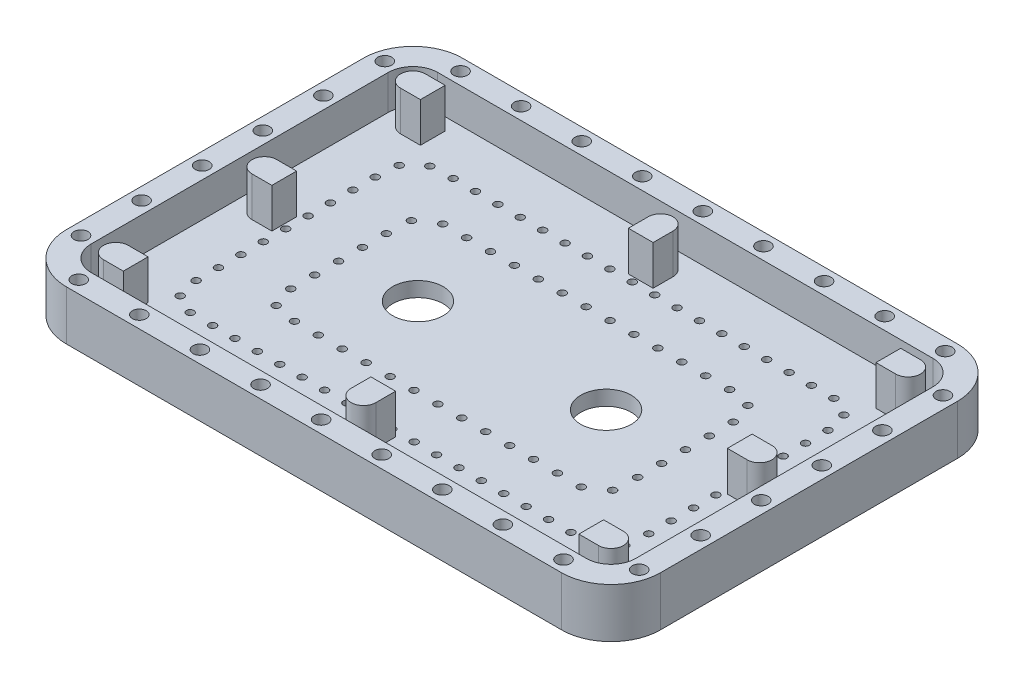
from build123d import *

# Parameters (mm, degrees)
SKETCH1_W                       = 120
SKETCH1_H                       = 80
BOSS_EXTRUDE1_DEPTH             = 10
SKETCH2_W                       = 110
SKETCH2_H                       = 70
CUT_EXTRUDE1_DEPTH              = 7
F_10_2_10_2_DIAMETER_HOLE1_D    = 10.2
FILLET1_R                       = 10
FILLET3_R                       = 5
F_2_5MM_CLEARANCE_DOWEL_HOLE1_D = 2.8
CRVPATTERN1_START               = -3
CRVPATTERN1_OUTLINE_R           = 1.4
CRVPATTERN1_DEPTH               = 10
F_1_5MM_DOWEL_HOLE2_D           = 1.5
CRVPATTERN3_START               = -3
CRVPATTERN3_OUTLINE_R           = 0.75
CRVPATTERN3_DEPTH               = 3
F_1_5MM_DOWEL_HOLE3_D           = 1.5
CRVPATTERN4_START               = -3
CRVPATTERN4_OUTLINE_R           = 0.75
CRVPATTERN4_DEPTH               = 3
BOSS_EXTRUDE2_DEPTH             = 8
SKETCH24_R                      = 2
CUT_EXTRUDE2_DEPTH              = 1.5
CRVPATTERN5_START               = -3
CRVPATTERN5_OUTLINE_R           = 2
CRVPATTERN5_OUTLINE_R_2         = 1.4
CRVPATTERN5_DEPTH               = 1.5


# Read off the part's stored shape, not the designer's step: CrvPattern1, CrvPattern3, CrvPattern4, CrvPattern5
with BuildPart() as part:
    # Sketch1 → Boss-Extrude1 (new body)
    with BuildSketch(Plane(origin=(0, 7, 0), x_dir=(1, 0, 0), z_dir=(0, 1, 0))):
        Rectangle(SKETCH1_W, SKETCH1_H)
    extrude(amount=-BOSS_EXTRUDE1_DEPTH)

    # Sketch2 → Cut-Extrude1 (cut)
    with BuildSketch(Plane(origin=(0, 7, 0), x_dir=(-1, 0, 0), z_dir=(0, 1, 0))):
        Rectangle(SKETCH2_W, SKETCH2_H)
    extrude(amount=-CUT_EXTRUDE1_DEPTH, mode=Mode.SUBTRACT)

    # Ø10.2 (10.2) Diameter Hole1 (through all)
    with Locations(Plane(origin=(0, 0, 0), x_dir=(1, 0, 0), z_dir=(0, 1, 0))):
        with Locations((19, 0), (-19, 0)):
            Hole(F_10_2_10_2_DIAMETER_HOLE1_D / 2)

    # Fillet1
    fillet1_edges = [part.edges().sort_by_distance(p)[0] for p in [
        (-60, 2, -40),
        (60, 2, -40),
        (60, 2, 40),
        (-60, 2, 40),
    ]]
    fillet(fillet1_edges, radius=FILLET1_R)

    # Fillet3
    fillet3_edges = [part.edges().sort_by_distance(p)[0] for p in [
        (-55, 3.5, 35),
        (-55, 3.5, -35),
        (55, 3.5, -35),
        (55, 3.5, 35),
    ]]
    fillet(fillet3_edges, radius=FILLET3_R)

    # Ø2.5mm Clearance Dowel Hole1 (through all)
    with Locations(Plane(origin=(0, 7, 0), x_dir=(1, 0, 0), z_dir=(0, 1, 0))):
        with Locations((50, 37.5)):
            Hole(F_2_5MM_CLEARANCE_DOWEL_HOLE1_D / 2)

    # CrvPattern1 outline → CrvPattern1 (cut)
    with BuildSketch(Plane(origin=(0, 0, 0), x_dir=(1, 0, 0), z_dir=(0, 1, 0)).offset(CRVPATTERN1_START)):
        with Locations((37.762537007, 37.5)):
            Circle(CRVPATTERN1_OUTLINE_R)
        with Locations((25.525074013, 37.5)):
            Circle(CRVPATTERN1_OUTLINE_R)
        with Locations((13.28761102, 37.5)):
            Circle(CRVPATTERN1_OUTLINE_R)
        with Locations((1.050148026, 37.5)):
            Circle(CRVPATTERN1_OUTLINE_R)
        with Locations((-11.187314967, 37.5)):
            Circle(CRVPATTERN1_OUTLINE_R)
        with Locations((-23.424777961, 37.5)):
            Circle(CRVPATTERN1_OUTLINE_R)
        with Locations((-35.662240954, 37.5)):
            Circle(CRVPATTERN1_OUTLINE_R)
        with Locations((-47.899703948, 37.5)):
            Circle(CRVPATTERN1_OUTLINE_R)
        with Locations((-57.320580195, 31.630676428)):
            Circle(CRVPATTERN1_OUTLINE_R)
        with Locations((-57.5, 19.406342516)):
            Circle(CRVPATTERN1_OUTLINE_R)
        with Locations((-57.5, 7.168879523)):
            Circle(CRVPATTERN1_OUTLINE_R)
        with Locations((-57.5, -5.068583471)):
            Circle(CRVPATTERN1_OUTLINE_R)
        with Locations((-57.5, -17.306046464)):
            Circle(CRVPATTERN1_OUTLINE_R)
        with Locations((-57.5, -29.543509458)):
            Circle(CRVPATTERN1_OUTLINE_R)
        with Locations((-50, -37.5)):
            Circle(CRVPATTERN1_OUTLINE_R)
        with Locations((-37.762537007, -37.5)):
            Circle(CRVPATTERN1_OUTLINE_R)
        with Locations((-25.525074013, -37.5)):
            Circle(CRVPATTERN1_OUTLINE_R)
        with Locations((-13.28761102, -37.5)):
            Circle(CRVPATTERN1_OUTLINE_R)
        with Locations((-1.050148026, -37.5)):
            Circle(CRVPATTERN1_OUTLINE_R)
        with Locations((11.187314967, -37.5)):
            Circle(CRVPATTERN1_OUTLINE_R)
        with Locations((23.424777961, -37.5)):
            Circle(CRVPATTERN1_OUTLINE_R)
        with Locations((35.662240954, -37.5)):
            Circle(CRVPATTERN1_OUTLINE_R)
        with Locations((47.899703948, -37.5)):
            Circle(CRVPATTERN1_OUTLINE_R)
        with Locations((57.320580195, -31.630676428)):
            Circle(CRVPATTERN1_OUTLINE_R)
        with Locations((57.5, -19.406342516)):
            Circle(CRVPATTERN1_OUTLINE_R)
        with Locations((57.5, -7.168879523)):
            Circle(CRVPATTERN1_OUTLINE_R)
        with Locations((57.5, 5.068583471)):
            Circle(CRVPATTERN1_OUTLINE_R)
        with Locations((57.5, 17.306046464)):
            Circle(CRVPATTERN1_OUTLINE_R)
        with Locations((57.5, 29.543509458)):
            Circle(CRVPATTERN1_OUTLINE_R)
    extrude(amount=CRVPATTERN1_DEPTH, mode=Mode.SUBTRACT)

    # Ø1.5mm Dowel Hole2 (through all)
    with Locations(Plane(origin=(0, 0, 0), x_dir=(1, 0, 0), z_dir=(0, 1, 0))):
        with Locations((40, 25)):
            Hole(F_1_5MM_DOWEL_HOLE2_D / 2)

    # CrvPattern3 outline → CrvPattern3 (cut)
    with BuildSketch(Plane(origin=(0, 0, 0), x_dir=(1, 0, 0), z_dir=(0, 1, 0)).offset(CRVPATTERN3_START)):
        with Locations((35.476401224, 25)):
            Circle(CRVPATTERN3_OUTLINE_R)
        with Locations((30.952802449, 25)):
            Circle(CRVPATTERN3_OUTLINE_R)
        with Locations((26.429203673, 25)):
            Circle(CRVPATTERN3_OUTLINE_R)
        with Locations((21.905604898, 25)):
            Circle(CRVPATTERN3_OUTLINE_R)
        with Locations((17.382006122, 25)):
            Circle(CRVPATTERN3_OUTLINE_R)
        with Locations((12.858407346, 25)):
            Circle(CRVPATTERN3_OUTLINE_R)
        with Locations((8.334808571, 25)):
            Circle(CRVPATTERN3_OUTLINE_R)
        with Locations((3.811209795, 25)):
            Circle(CRVPATTERN3_OUTLINE_R)
        with Locations((-0.71238898, 25)):
            Circle(CRVPATTERN3_OUTLINE_R)
        with Locations((-5.235987756, 25)):
            Circle(CRVPATTERN3_OUTLINE_R)
        with Locations((-9.759586532, 25)):
            Circle(CRVPATTERN3_OUTLINE_R)
        with Locations((-14.283185307, 25)):
            Circle(CRVPATTERN3_OUTLINE_R)
        with Locations((-18.806784083, 25)):
            Circle(CRVPATTERN3_OUTLINE_R)
        with Locations((-23.330382858, 25)):
            Circle(CRVPATTERN3_OUTLINE_R)
        with Locations((-27.853981634, 25)):
            Circle(CRVPATTERN3_OUTLINE_R)
        with Locations((-32.37758041, 25)):
            Circle(CRVPATTERN3_OUTLINE_R)
        with Locations((-36.901179185, 25)):
            Circle(CRVPATTERN3_OUTLINE_R)
        with Locations((-41.405574173, 24.798370687)):
            Circle(CRVPATTERN3_OUTLINE_R)
        with Locations((-44.64124129, 21.859806251)):
            Circle(CRVPATTERN3_OUTLINE_R)
        with Locations((-45, 17.382006122)):
            Circle(CRVPATTERN3_OUTLINE_R)
        with Locations((-45, 12.858407346)):
            Circle(CRVPATTERN3_OUTLINE_R)
        with Locations((-45, 8.334808571)):
            Circle(CRVPATTERN3_OUTLINE_R)
        with Locations((-45, 3.811209795)):
            Circle(CRVPATTERN3_OUTLINE_R)
        with Locations((-45, -0.71238898)):
            Circle(CRVPATTERN3_OUTLINE_R)
        with Locations((-45, -5.235987756)):
            Circle(CRVPATTERN3_OUTLINE_R)
        with Locations((-45, -9.759586532)):
            Circle(CRVPATTERN3_OUTLINE_R)
        with Locations((-45, -14.283185307)):
            Circle(CRVPATTERN3_OUTLINE_R)
        with Locations((-45, -18.806784083)):
            Circle(CRVPATTERN3_OUTLINE_R)
        with Locations((-43.931260104, -23.089529736)):
            Circle(CRVPATTERN3_OUTLINE_R)
        with Locations((-40, -25)):
            Circle(CRVPATTERN3_OUTLINE_R)
        with Locations((-35.476401224, -25)):
            Circle(CRVPATTERN3_OUTLINE_R)
        with Locations((-30.952802449, -25)):
            Circle(CRVPATTERN3_OUTLINE_R)
        with Locations((-26.429203673, -25)):
            Circle(CRVPATTERN3_OUTLINE_R)
        with Locations((-21.905604898, -25)):
            Circle(CRVPATTERN3_OUTLINE_R)
        with Locations((-17.382006122, -25)):
            Circle(CRVPATTERN3_OUTLINE_R)
        with Locations((-12.858407346, -25)):
            Circle(CRVPATTERN3_OUTLINE_R)
        with Locations((-8.334808571, -25)):
            Circle(CRVPATTERN3_OUTLINE_R)
        with Locations((-3.811209795, -25)):
            Circle(CRVPATTERN3_OUTLINE_R)
        with Locations((0.71238898, -25)):
            Circle(CRVPATTERN3_OUTLINE_R)
        with Locations((5.235987756, -25)):
            Circle(CRVPATTERN3_OUTLINE_R)
        with Locations((9.759586532, -25)):
            Circle(CRVPATTERN3_OUTLINE_R)
        with Locations((14.283185307, -25)):
            Circle(CRVPATTERN3_OUTLINE_R)
        with Locations((18.806784083, -25)):
            Circle(CRVPATTERN3_OUTLINE_R)
        with Locations((23.330382858, -25)):
            Circle(CRVPATTERN3_OUTLINE_R)
        with Locations((27.853981634, -25)):
            Circle(CRVPATTERN3_OUTLINE_R)
        with Locations((32.37758041, -25)):
            Circle(CRVPATTERN3_OUTLINE_R)
        with Locations((36.901179185, -25)):
            Circle(CRVPATTERN3_OUTLINE_R)
        with Locations((41.405574173, -24.798370687)):
            Circle(CRVPATTERN3_OUTLINE_R)
        with Locations((44.64124129, -21.859806251)):
            Circle(CRVPATTERN3_OUTLINE_R)
        with Locations((45, -17.382006122)):
            Circle(CRVPATTERN3_OUTLINE_R)
        with Locations((45, -12.858407346)):
            Circle(CRVPATTERN3_OUTLINE_R)
        with Locations((45, -8.334808571)):
            Circle(CRVPATTERN3_OUTLINE_R)
        with Locations((45, -3.811209795)):
            Circle(CRVPATTERN3_OUTLINE_R)
        with Locations((45, 0.71238898)):
            Circle(CRVPATTERN3_OUTLINE_R)
        with Locations((45, 5.235987756)):
            Circle(CRVPATTERN3_OUTLINE_R)
        with Locations((45, 9.759586532)):
            Circle(CRVPATTERN3_OUTLINE_R)
        with Locations((45, 14.283185307)):
            Circle(CRVPATTERN3_OUTLINE_R)
        with Locations((45, 18.806784083)):
            Circle(CRVPATTERN3_OUTLINE_R)
        with Locations((43.931260104, 23.089529736)):
            Circle(CRVPATTERN3_OUTLINE_R)
    extrude(amount=CRVPATTERN3_DEPTH, mode=Mode.SUBTRACT)

    # Ø1.5mm Dowel Hole3 (through all)
    with Locations(Plane(origin=(0, -3, 0), x_dir=(-1, 0, 0), z_dir=(0, -1, 0))):
        with Locations((-30, -16)):
            Hole(F_1_5MM_DOWEL_HOLE3_D / 2)

    # CrvPattern4 outline → CrvPattern4 (cut)
    with BuildSketch(Plane(origin=(0, 0, 0), x_dir=(1, 0, 0), z_dir=(0, 1, 0)).offset(CRVPATTERN4_START)):
        with Locations((25.171681469, -16)):
            Circle(CRVPATTERN4_OUTLINE_R)
        with Locations((20.343362939, -16)):
            Circle(CRVPATTERN4_OUTLINE_R)
        with Locations((15.515044408, -16)):
            Circle(CRVPATTERN4_OUTLINE_R)
        with Locations((10.686725877, -16)):
            Circle(CRVPATTERN4_OUTLINE_R)
        with Locations((5.858407346, -16)):
            Circle(CRVPATTERN4_OUTLINE_R)
        with Locations((1.030088816, -16)):
            Circle(CRVPATTERN4_OUTLINE_R)
        with Locations((-3.798229715, -16)):
            Circle(CRVPATTERN4_OUTLINE_R)
        with Locations((-8.626548246, -16)):
            Circle(CRVPATTERN4_OUTLINE_R)
        with Locations((-13.454866776, -16)):
            Circle(CRVPATTERN4_OUTLINE_R)
        with Locations((-18.283185307, -16)):
            Circle(CRVPATTERN4_OUTLINE_R)
        with Locations((-23.111503838, -16)):
            Circle(CRVPATTERN4_OUTLINE_R)
        with Locations((-27.939822369, -16)):
            Circle(CRVPATTERN4_OUTLINE_R)
        with Locations((-32.552422087, -15.079795689)):
            Circle(CRVPATTERN4_OUTLINE_R)
        with Locations((-34, -10.686725877)):
            Circle(CRVPATTERN4_OUTLINE_R)
        with Locations((-34, -5.858407346)):
            Circle(CRVPATTERN4_OUTLINE_R)
        with Locations((-34, -1.030088816)):
            Circle(CRVPATTERN4_OUTLINE_R)
        with Locations((-34, 3.798229715)):
            Circle(CRVPATTERN4_OUTLINE_R)
        with Locations((-34, 8.626548246)):
            Circle(CRVPATTERN4_OUTLINE_R)
        with Locations((-33.738324268, 13.423000937)):
            Circle(CRVPATTERN4_OUTLINE_R)
        with Locations((-30, 16)):
            Circle(CRVPATTERN4_OUTLINE_R)
        with Locations((-25.171681469, 16)):
            Circle(CRVPATTERN4_OUTLINE_R)
        with Locations((-20.343362939, 16)):
            Circle(CRVPATTERN4_OUTLINE_R)
        with Locations((-15.515044408, 16)):
            Circle(CRVPATTERN4_OUTLINE_R)
        with Locations((-10.686725877, 16)):
            Circle(CRVPATTERN4_OUTLINE_R)
        with Locations((-5.858407346, 16)):
            Circle(CRVPATTERN4_OUTLINE_R)
        with Locations((-1.030088816, 16)):
            Circle(CRVPATTERN4_OUTLINE_R)
        with Locations((3.798229715, 16)):
            Circle(CRVPATTERN4_OUTLINE_R)
        with Locations((8.626548246, 16)):
            Circle(CRVPATTERN4_OUTLINE_R)
        with Locations((13.454866776, 16)):
            Circle(CRVPATTERN4_OUTLINE_R)
        with Locations((18.283185307, 16)):
            Circle(CRVPATTERN4_OUTLINE_R)
        with Locations((23.111503838, 16)):
            Circle(CRVPATTERN4_OUTLINE_R)
        with Locations((27.939822369, 16)):
            Circle(CRVPATTERN4_OUTLINE_R)
        with Locations((32.552422087, 15.079795689)):
            Circle(CRVPATTERN4_OUTLINE_R)
        with Locations((34, 10.686725877)):
            Circle(CRVPATTERN4_OUTLINE_R)
        with Locations((34, 5.858407346)):
            Circle(CRVPATTERN4_OUTLINE_R)
        with Locations((34, 1.030088816)):
            Circle(CRVPATTERN4_OUTLINE_R)
        with Locations((34, -3.798229715)):
            Circle(CRVPATTERN4_OUTLINE_R)
        with Locations((34, -8.626548246)):
            Circle(CRVPATTERN4_OUTLINE_R)
        with Locations((33.738324268, -13.423000937)):
            Circle(CRVPATTERN4_OUTLINE_R)
    extrude(amount=CRVPATTERN4_DEPTH, mode=Mode.SUBTRACT)

    # Sketch23 → Boss-Extrude2 (add)
    with BuildSketch(Plane(origin=(0, 0, 0), x_dir=(1, 0, 0), z_dir=(0, 1, 0))):
        with BuildLine():
            ThreePointArc((52.5, -30), (51.767766953, -28.232233047), (50, -27.5))
            Line((50, -27.5), (50, -32.5))
            ThreePointArc((50, -32.5), (51.767766953, -31.767766953), (52.5, -30))
        make_face()
        with BuildLine():
            Line((50, -32.5), (50, -27.5))
            ThreePointArc((50, -27.5), (47.5, -30), (50, -32.5))
        make_face()
        with BuildLine():
            ThreePointArc((50, -32.5), (47.5, -30), (50, -27.5))
            Line((50, -27.5), (46, -27.5))
            Line((46, -27.5), (46, -32.5))
            Line((46, -32.5), (50, -32.5))
        make_face()
        with BuildLine():
            Line((46, -2.5), (50, -2.5))
            ThreePointArc((50, -2.5), (47.5, 0), (50, 2.5))
            Line((50, 2.5), (46, 2.5))
            Line((46, 2.5), (46, -2.5))
        make_face()
        with BuildLine():
            ThreePointArc((50, 2.5), (47.5, 0), (50, -2.5))
            Line((50, -2.5), (50, 2.5))
        make_face()
        with BuildLine():
            Line((50, 2.5), (50, -2.5))
            ThreePointArc((50, -2.5), (51.767766953, -1.767766953), (52.5, 0))
            ThreePointArc((52.5, 0), (51.767766953, 1.767766953), (50, 2.5))
        make_face()
        with BuildLine():
            Line((46, 27.5), (50, 27.5))
            ThreePointArc((50, 27.5), (47.5, 30), (50, 32.5))
            Line((50, 32.5), (46, 32.5))
            Line((46, 32.5), (46, 27.5))
        make_face()
        with BuildLine():
            ThreePointArc((50, 32.5), (47.5, 30), (50, 27.5))
            Line((50, 27.5), (50, 32.5))
        make_face()
        with BuildLine():
            Line((50, 32.5), (50, 27.5))
            ThreePointArc((50, 27.5), (51.767766953, 28.232233047), (52.5, 30))
            ThreePointArc((52.5, 30), (51.767766953, 31.767766953), (50, 32.5))
        make_face()
        with BuildLine():
            ThreePointArc((2.5, 30), (0, 27.5), (-2.5, 30))
            Line((-2.5, 30), (-2.5, 26))
            Line((-2.5, 26), (2.5, 26))
            Line((2.5, 26), (2.5, 30))
        make_face()
        with BuildLine():
            ThreePointArc((2.5, 30), (0, 32.5), (-2.5, 30))
            Line((-2.5, 30), (2.5, 30))
        make_face()
        with BuildLine():
            Line((2.5, 30), (-2.5, 30))
            ThreePointArc((-2.5, 30), (0, 27.5), (2.5, 30))
        make_face()
        with BuildLine():
            ThreePointArc((-2.5, -30), (0, -27.5), (2.5, -30))
            Line((2.5, -30), (2.5, -26))
            Line((2.5, -26), (-2.5, -26))
            Line((-2.5, -26), (-2.5, -30))
        make_face()
        with BuildLine():
            ThreePointArc((-2.5, -30), (0, -32.5), (2.5, -30))
            Line((2.5, -30), (-2.5, -30))
        make_face()
        with BuildLine():
            Line((-2.5, -30), (2.5, -30))
            ThreePointArc((2.5, -30), (0, -27.5), (-2.5, -30))
        make_face()
        with BuildLine():
            ThreePointArc((-50, -27.5), (-52.5, -30), (-50, -32.5))
            Line((-50, -32.5), (-50, -27.5))
        make_face()
        with BuildLine():
            Line((-50, -27.5), (-50, -32.5))
            ThreePointArc((-50, -32.5), (-48.232233047, -31.767766953), (-47.5, -30))
            ThreePointArc((-47.5, -30), (-48.232233047, -28.232233047), (-50, -27.5))
        make_face()
        with BuildLine():
            ThreePointArc((-47.5, -30), (-48.232233047, -31.767766953), (-50, -32.5))
            Line((-50, -32.5), (-46, -32.5))
            Line((-46, -32.5), (-46, -27.5))
            Line((-46, -27.5), (-50, -27.5))
            ThreePointArc((-50, -27.5), (-48.232233047, -28.232233047), (-47.5, -30))
        make_face()
        with BuildLine():
            ThreePointArc((-50, 32.5), (-52.5, 30), (-50, 27.5))
            Line((-50, 27.5), (-50, 32.5))
        make_face()
        with BuildLine():
            Line((-50, 32.5), (-50, 27.5))
            ThreePointArc((-50, 27.5), (-48.232233047, 28.232233047), (-47.5, 30))
            ThreePointArc((-47.5, 30), (-48.232233047, 31.767766953), (-50, 32.5))
        make_face()
        with BuildLine():
            ThreePointArc((-47.5, 30), (-48.232233047, 28.232233047), (-50, 27.5))
            Line((-50, 27.5), (-46, 27.5))
            Line((-46, 27.5), (-46, 32.5))
            Line((-46, 32.5), (-50, 32.5))
            ThreePointArc((-50, 32.5), (-48.232233047, 31.767766953), (-47.5, 30))
        make_face()
        with BuildLine():
            ThreePointArc((-50, 2.5), (-52.5, 0), (-50, -2.5))
            Line((-50, -2.5), (-50, 2.5))
        make_face()
        with BuildLine():
            Line((-50, 2.5), (-50, -2.5))
            ThreePointArc((-50, -2.5), (-48.232233047, -1.767766953), (-47.5, 0))
            ThreePointArc((-47.5, 0), (-48.232233047, 1.767766953), (-50, 2.5))
        make_face()
        with BuildLine():
            ThreePointArc((-47.5, 0), (-48.232233047, -1.767766953), (-50, -2.5))
            Line((-50, -2.5), (-46, -2.5))
            Line((-46, -2.5), (-46, 2.5))
            Line((-46, 2.5), (-50, 2.5))
            ThreePointArc((-50, 2.5), (-48.232233047, 1.767766953), (-47.5, 0))
        make_face()
    extrude(amount=BOSS_EXTRUDE2_DEPTH)

    # Sketch24 → Cut-Extrude2 (cut)
    with BuildSketch(Plane.XZ.offset(3)):
        with Locations(Location((57.5, 19.406342516, 0), (0, 0, 270))):
            Circle(SKETCH24_R)
    extrude(amount=-CUT_EXTRUDE2_DEPTH, mode=Mode.SUBTRACT)

    # CrvPattern5 outline → CrvPattern5 (cut)
    # profile 1 of 29: a face of its own
    with BuildSketch(Plane(origin=(0, 0, 0), x_dir=(1, 0, 0), z_dir=(0, 1, 0)).offset(CRVPATTERN5_START)):
        with Locations((57.5, 29.543509458)):
            Circle(CRVPATTERN5_OUTLINE_R)
        with Locations((57.5, 29.543509458)):
            Circle(CRVPATTERN5_OUTLINE_R_2, mode=Mode.SUBTRACT)
    # profile 2 of 29: a face of its own
    with BuildSketch(Plane(origin=(0, 0, 0), x_dir=(1, 0, 0), z_dir=(0, 1, 0)).offset(CRVPATTERN5_START)):
        with Locations((57.5, 17.306046464)):
            Circle(CRVPATTERN5_OUTLINE_R)
        with Locations((57.5, 17.306046464)):
            Circle(CRVPATTERN5_OUTLINE_R_2, mode=Mode.SUBTRACT)
    # profile 3 of 29: a face of its own
    with BuildSketch(Plane(origin=(0, 0, 0), x_dir=(1, 0, 0), z_dir=(0, 1, 0)).offset(CRVPATTERN5_START)):
        with Locations((57.5, 5.068583471)):
            Circle(CRVPATTERN5_OUTLINE_R)
        with Locations((57.5, 5.068583471)):
            Circle(CRVPATTERN5_OUTLINE_R_2, mode=Mode.SUBTRACT)
    # profile 4 of 29: a face of its own
    with BuildSketch(Plane(origin=(0, 0, 0), x_dir=(1, 0, 0), z_dir=(0, 1, 0)).offset(CRVPATTERN5_START)):
        with Locations((57.5, -7.168879523)):
            Circle(CRVPATTERN5_OUTLINE_R)
        with Locations((57.5, -7.168879523)):
            Circle(CRVPATTERN5_OUTLINE_R_2, mode=Mode.SUBTRACT)
    # profile 5 of 29: a face of its own
    with BuildSketch(Plane(origin=(0, 0, 0), x_dir=(1, 0, 0), z_dir=(0, 1, 0)).offset(CRVPATTERN5_START)):
        with Locations((57.320580195, -31.630676428)):
            Circle(CRVPATTERN5_OUTLINE_R)
        with Locations((57.320580195, -31.630676428)):
            Circle(CRVPATTERN5_OUTLINE_R_2, mode=Mode.SUBTRACT)
    # profile 6 of 29: a face of its own
    with BuildSketch(Plane(origin=(0, 0, 0), x_dir=(1, 0, 0), z_dir=(0, 1, 0)).offset(CRVPATTERN5_START)):
        with Locations((47.899703948, -37.5)):
            Circle(CRVPATTERN5_OUTLINE_R)
        with Locations((47.899703948, -37.5)):
            Circle(CRVPATTERN5_OUTLINE_R_2, mode=Mode.SUBTRACT)
    # profile 7 of 29: a face of its own
    with BuildSketch(Plane(origin=(0, 0, 0), x_dir=(1, 0, 0), z_dir=(0, 1, 0)).offset(CRVPATTERN5_START)):
        with Locations((35.662240954, -37.5)):
            Circle(CRVPATTERN5_OUTLINE_R)
        with Locations((35.662240954, -37.5)):
            Circle(CRVPATTERN5_OUTLINE_R_2, mode=Mode.SUBTRACT)
    # profile 8 of 29: a face of its own
    with BuildSketch(Plane(origin=(0, 0, 0), x_dir=(1, 0, 0), z_dir=(0, 1, 0)).offset(CRVPATTERN5_START)):
        with Locations((23.424777961, -37.5)):
            Circle(CRVPATTERN5_OUTLINE_R)
        with Locations((23.424777961, -37.5)):
            Circle(CRVPATTERN5_OUTLINE_R_2, mode=Mode.SUBTRACT)
    # profile 9 of 29: a face of its own
    with BuildSketch(Plane(origin=(0, 0, 0), x_dir=(1, 0, 0), z_dir=(0, 1, 0)).offset(CRVPATTERN5_START)):
        with Locations((11.187314967, -37.5)):
            Circle(CRVPATTERN5_OUTLINE_R)
        with Locations((11.187314967, -37.5)):
            Circle(CRVPATTERN5_OUTLINE_R_2, mode=Mode.SUBTRACT)
    # profile 10 of 29: a face of its own
    with BuildSketch(Plane(origin=(0, 0, 0), x_dir=(1, 0, 0), z_dir=(0, 1, 0)).offset(CRVPATTERN5_START)):
        with Locations((-1.050148026, -37.5)):
            Circle(CRVPATTERN5_OUTLINE_R)
        with Locations((-1.050148026, -37.5)):
            Circle(CRVPATTERN5_OUTLINE_R_2, mode=Mode.SUBTRACT)
    # profile 11 of 29: a face of its own
    with BuildSketch(Plane(origin=(0, 0, 0), x_dir=(1, 0, 0), z_dir=(0, 1, 0)).offset(CRVPATTERN5_START)):
        with Locations((-13.28761102, -37.5)):
            Circle(CRVPATTERN5_OUTLINE_R)
        with Locations((-13.28761102, -37.5)):
            Circle(CRVPATTERN5_OUTLINE_R_2, mode=Mode.SUBTRACT)
    # profile 12 of 29: a face of its own
    with BuildSketch(Plane(origin=(0, 0, 0), x_dir=(1, 0, 0), z_dir=(0, 1, 0)).offset(CRVPATTERN5_START)):
        with Locations((-25.525074013, -37.5)):
            Circle(CRVPATTERN5_OUTLINE_R)
        with Locations((-25.525074013, -37.5)):
            Circle(CRVPATTERN5_OUTLINE_R_2, mode=Mode.SUBTRACT)
    # profile 13 of 29: a face of its own
    with BuildSketch(Plane(origin=(0, 0, 0), x_dir=(1, 0, 0), z_dir=(0, 1, 0)).offset(CRVPATTERN5_START)):
        with Locations((-37.762537007, -37.5)):
            Circle(CRVPATTERN5_OUTLINE_R)
        with Locations((-37.762537007, -37.5)):
            Circle(CRVPATTERN5_OUTLINE_R_2, mode=Mode.SUBTRACT)
    # profile 14 of 29: a face of its own
    with BuildSketch(Plane(origin=(0, 0, 0), x_dir=(1, 0, 0), z_dir=(0, 1, 0)).offset(CRVPATTERN5_START)):
        with Locations((-50, -37.5)):
            Circle(CRVPATTERN5_OUTLINE_R)
        with Locations((-50, -37.5)):
            Circle(CRVPATTERN5_OUTLINE_R_2, mode=Mode.SUBTRACT)
    # profile 15 of 29: a face of its own
    with BuildSketch(Plane(origin=(0, 0, 0), x_dir=(1, 0, 0), z_dir=(0, 1, 0)).offset(CRVPATTERN5_START)):
        with Locations((-57.5, -29.543509458)):
            Circle(CRVPATTERN5_OUTLINE_R)
        with Locations((-57.5, -29.543509458)):
            Circle(CRVPATTERN5_OUTLINE_R_2, mode=Mode.SUBTRACT)
    # profile 16 of 29: a face of its own
    with BuildSketch(Plane(origin=(0, 0, 0), x_dir=(1, 0, 0), z_dir=(0, 1, 0)).offset(CRVPATTERN5_START)):
        with Locations((-57.5, -17.306046464)):
            Circle(CRVPATTERN5_OUTLINE_R)
        with Locations((-57.5, -17.306046464)):
            Circle(CRVPATTERN5_OUTLINE_R_2, mode=Mode.SUBTRACT)
    # profile 17 of 29: a face of its own
    with BuildSketch(Plane(origin=(0, 0, 0), x_dir=(1, 0, 0), z_dir=(0, 1, 0)).offset(CRVPATTERN5_START)):
        with Locations((-57.5, -5.068583471)):
            Circle(CRVPATTERN5_OUTLINE_R)
        with Locations((-57.5, -5.068583471)):
            Circle(CRVPATTERN5_OUTLINE_R_2, mode=Mode.SUBTRACT)
    # profile 18 of 29: a face of its own
    with BuildSketch(Plane(origin=(0, 0, 0), x_dir=(1, 0, 0), z_dir=(0, 1, 0)).offset(CRVPATTERN5_START)):
        with Locations((-57.5, 7.168879523)):
            Circle(CRVPATTERN5_OUTLINE_R)
        with Locations((-57.5, 7.168879523)):
            Circle(CRVPATTERN5_OUTLINE_R_2, mode=Mode.SUBTRACT)
    # profile 19 of 29: a face of its own
    with BuildSketch(Plane(origin=(0, 0, 0), x_dir=(1, 0, 0), z_dir=(0, 1, 0)).offset(CRVPATTERN5_START)):
        with Locations((-57.5, 19.406342516)):
            Circle(CRVPATTERN5_OUTLINE_R)
        with Locations((-57.5, 19.406342516)):
            Circle(CRVPATTERN5_OUTLINE_R_2, mode=Mode.SUBTRACT)
    # profile 20 of 29: a face of its own
    with BuildSketch(Plane(origin=(0, 0, 0), x_dir=(1, 0, 0), z_dir=(0, 1, 0)).offset(CRVPATTERN5_START)):
        with Locations((-57.320580195, 31.630676428)):
            Circle(CRVPATTERN5_OUTLINE_R)
        with Locations((-57.320580195, 31.630676428)):
            Circle(CRVPATTERN5_OUTLINE_R_2, mode=Mode.SUBTRACT)
    # profile 21 of 29: a face of its own
    with BuildSketch(Plane(origin=(0, 0, 0), x_dir=(1, 0, 0), z_dir=(0, 1, 0)).offset(CRVPATTERN5_START)):
        with Locations((-47.899703948, 37.5)):
            Circle(CRVPATTERN5_OUTLINE_R)
        with Locations((-47.899703948, 37.5)):
            Circle(CRVPATTERN5_OUTLINE_R_2, mode=Mode.SUBTRACT)
    # profile 22 of 29: a face of its own
    with BuildSketch(Plane(origin=(0, 0, 0), x_dir=(1, 0, 0), z_dir=(0, 1, 0)).offset(CRVPATTERN5_START)):
        with Locations((-35.662240954, 37.5)):
            Circle(CRVPATTERN5_OUTLINE_R)
        with Locations((-35.662240954, 37.5)):
            Circle(CRVPATTERN5_OUTLINE_R_2, mode=Mode.SUBTRACT)
    # profile 23 of 29: a face of its own
    with BuildSketch(Plane(origin=(0, 0, 0), x_dir=(1, 0, 0), z_dir=(0, 1, 0)).offset(CRVPATTERN5_START)):
        with Locations((-23.424777961, 37.5)):
            Circle(CRVPATTERN5_OUTLINE_R)
        with Locations((-23.424777961, 37.5)):
            Circle(CRVPATTERN5_OUTLINE_R_2, mode=Mode.SUBTRACT)
    # profile 24 of 29: a face of its own
    with BuildSketch(Plane(origin=(0, 0, 0), x_dir=(1, 0, 0), z_dir=(0, 1, 0)).offset(CRVPATTERN5_START)):
        with Locations((-11.187314967, 37.5)):
            Circle(CRVPATTERN5_OUTLINE_R)
        with Locations((-11.187314967, 37.5)):
            Circle(CRVPATTERN5_OUTLINE_R_2, mode=Mode.SUBTRACT)
    # profile 25 of 29: a face of its own
    with BuildSketch(Plane(origin=(0, 0, 0), x_dir=(1, 0, 0), z_dir=(0, 1, 0)).offset(CRVPATTERN5_START)):
        with Locations((1.050148026, 37.5)):
            Circle(CRVPATTERN5_OUTLINE_R)
        with Locations((1.050148026, 37.5)):
            Circle(CRVPATTERN5_OUTLINE_R_2, mode=Mode.SUBTRACT)
    # profile 26 of 29: a face of its own
    with BuildSketch(Plane(origin=(0, 0, 0), x_dir=(1, 0, 0), z_dir=(0, 1, 0)).offset(CRVPATTERN5_START)):
        with Locations((13.28761102, 37.5)):
            Circle(CRVPATTERN5_OUTLINE_R)
        with Locations((13.28761102, 37.5)):
            Circle(CRVPATTERN5_OUTLINE_R_2, mode=Mode.SUBTRACT)
    # profile 27 of 29: a face of its own
    with BuildSketch(Plane(origin=(0, 0, 0), x_dir=(1, 0, 0), z_dir=(0, 1, 0)).offset(CRVPATTERN5_START)):
        with Locations((25.525074013, 37.5)):
            Circle(CRVPATTERN5_OUTLINE_R)
        with Locations((25.525074013, 37.5)):
            Circle(CRVPATTERN5_OUTLINE_R_2, mode=Mode.SUBTRACT)
    # profile 28 of 29: a face of its own
    with BuildSketch(Plane(origin=(0, 0, 0), x_dir=(1, 0, 0), z_dir=(0, 1, 0)).offset(CRVPATTERN5_START)):
        with Locations((37.762537007, 37.5)):
            Circle(CRVPATTERN5_OUTLINE_R)
        with Locations((37.762537007, 37.5)):
            Circle(CRVPATTERN5_OUTLINE_R_2, mode=Mode.SUBTRACT)
    # profile 29 of 29: a face of its own
    with BuildSketch(Plane(origin=(0, 0, 0), x_dir=(1, 0, 0), z_dir=(0, 1, 0)).offset(CRVPATTERN5_START)):
        with Locations((50, 37.5)):
            Circle(CRVPATTERN5_OUTLINE_R)
        with Locations((50, 37.5)):
            Circle(CRVPATTERN5_OUTLINE_R_2, mode=Mode.SUBTRACT)
    extrude(amount=CRVPATTERN5_DEPTH, mode=Mode.SUBTRACT)


solid = part.part
